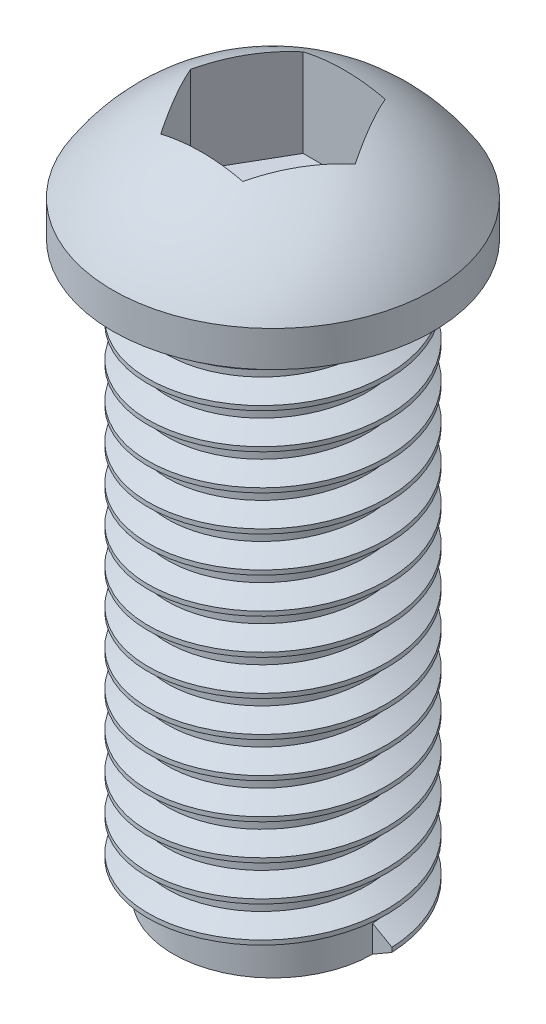
from build123d import *

# Parameters (mm, degrees)
SKETCH1_R           = 1.4
BOSS_EXTRUDE1_DEPTH = 8
CUT_EXTRUDE1_START  = 1.75
CUT_EXTRUDE1_DEPTH  = 1.5
THREAD2_PITCH       = 0.5


with BuildPart() as part:
    # Sketch1 → Boss-Extrude1 (new body)
    with BuildSketch(Plane(origin=(0, 0, 0), x_dir=(1, 0, 0), z_dir=(0, 1, 0))):
        with Locations(Location((0, 0, 0), (0, 0, 270))):
            Circle(SKETCH1_R)
    extrude(amount=-BOSS_EXTRUDE1_DEPTH)

    # Sketch2 → Revolve1 (revolve)
    with BuildSketch(Plane.XY):
        with BuildLine():
            Line((0, 0), (2.25, 0))
            Line((2.25, 0), (2.25, 0.5))
            ThreePointArc((2.25, 0.5), (1.286953768, 1.416516782), (0, 1.75))
            Line((0, 1.75), (0, 0))
        make_face()
    revolve(axis=Axis((0, 0, 0), (0, 1, 0)))

    # Sketch3 → Cut-Extrude1 (cut)
    with BuildSketch(Plane(origin=(0, 0, 0), x_dir=(1, 0, 0), z_dir=(0, 1, 0)).offset(CUT_EXTRUDE1_START)):
        Polygon((1.154700538, 0), (0.577350269, 1), (-0.577350269, 1), (-1.154700538, 0), (-0.577350269, -1), (0.577350269, -1), align=None)
    extrude(amount=-CUT_EXTRUDE1_DEPTH, mode=Mode.SUBTRACT)

    # Thread2: the profile of Thread Profile2 profile screwed along a right-hand helix of 16 turns, 6 arcs to a turn; built about Z, then put on its axis
    thread2_z = Axis((0, 0, 0), (0, 0, 1))
    thread2_corners = [(1.3997, 0, -0.000173205), (1.670632937, 0, 0.156249999), (1.670632937, 0, 0.218749999), (1.3997, 0, 0.375173204)]
    with BuildLine(mode=Mode.PRIVATE) as thread2_profile:
        Line(thread2_corners[0], thread2_corners[1])
        Line(thread2_corners[1], thread2_corners[2])
        Line(thread2_corners[2], thread2_corners[3])
        Line(thread2_corners[3], thread2_corners[0])
    thread2_cap = Face(thread2_profile.wire())
    thread2_turn_angles = [0, 30, 60, 90, 120, 150, 180, 210, 240, 270, 300, 330, 360]
    thread2_turn_weights = [1, 0.8660254037844387, 1, 0.8660254037844387, 1, 0.8660254037844387, 1, 0.8660254037844387, 1, 0.8660254037844387, 1, 0.8660254037844387, 1]
    thread2_turn_rails = [Edge.make_bspline([Vector(p[0], p[1], 0).rotate(thread2_z, thread2_turn_angles[k]) / thread2_turn_weights[k] + Vector(0, 0, p[2] + THREAD2_PITCH * thread2_turn_angles[k] / 360) for k in range(13)], [0, 0, 0, 1, 1, 2, 2, 3, 3, 4, 4, 5, 5, 6, 6, 6], 2, thread2_turn_weights) for p in thread2_corners]
    thread2_turn_sides = [Face.make_surface_from_curves(thread2_turn_rails[p[0]], thread2_turn_rails[p[1]]) for p in [(0, 1), (1, 2), (2, 3), (3, 0)]]
    thread2 = Plane(origin=(0, -8, 0), x_dir=(1, 0, 0), z_dir=(0, 1, 0)) * Solid(Shell([*[p.moved(Location((0, 0, THREAD2_PITCH * i))) for i in range(16) for p in thread2_turn_sides], thread2_cap, thread2_cap.rotate(thread2_z, 5760).moved(Location((0, 0, THREAD2_PITCH * 5760 / 360)))]))
    add(thread2)


solid = part.part
